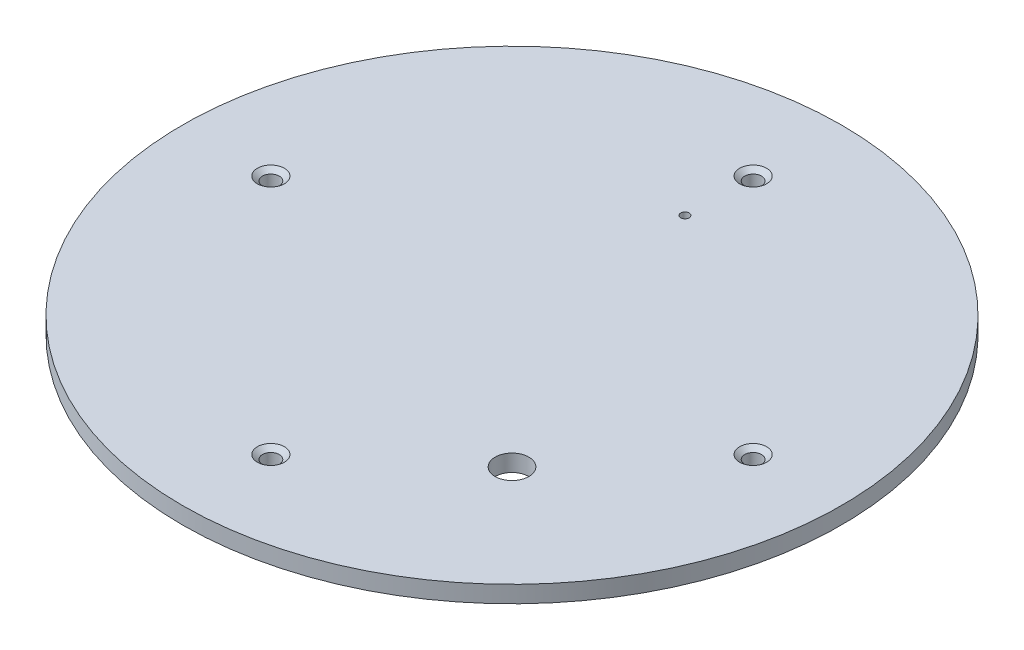
from build123d import *

# Parameters (mm, degrees)
SKETCH1_R                                       = 19.53
BOSS_EXTRUDE1_DEPTH                             = 1
CSK_FOR_M2_FLAT_HEAD_MACHINE_SCREW1_D           = 1
CSK_FOR_M2_FLAT_HEAD_MACHINE_SCREW1_CSINK_D     = 1.6
CSK_FOR_M2_FLAT_HEAD_MACHINE_SCREW1_CSINK_ANGLE = 100
CUT_EXTRUDE1_DEPTH                              = 28.637688036
CUT_EXTRUDE1_DEPTH_BACK                         = 28.637688036
SKETCH4_R                                       = 0.25
CUT_EXTRUDE2_DEPTH                              = 28.637688036
CUT_EXTRUDE2_DEPTH_BACK                         = 28.637688036
SKETCH5_R                                       = 1


with BuildPart() as part:
    # Sketch1 → Boss-Extrude1 (new body)
    with BuildSketch(Plane(origin=(0, 0, 0), x_dir=(1, 0, 0), z_dir=(0, 1, 0))):
        Circle(SKETCH1_R)
    extrude(amount=BOSS_EXTRUDE1_DEPTH)

    # CSK for M2 Flat Head Machine Screw1 (through all)
    with Locations(Plane(origin=(0, 1, 0), x_dir=(1, 0, 0), z_dir=(0, 1, 0))):
        with Locations((0, 14.29), (14.29, 0), (0, -14.29), (-14.29, 0)):
            CounterSinkHole(CSK_FOR_M2_FLAT_HEAD_MACHINE_SCREW1_D / 2, CSK_FOR_M2_FLAT_HEAD_MACHINE_SCREW1_CSINK_D / 2, counter_sink_angle=CSK_FOR_M2_FLAT_HEAD_MACHINE_SCREW1_CSINK_ANGLE)

    # Sketch4 → Cut-Extrude1 (cut, two sides: drawn at the far end of the back side and taken through both)
    with BuildSketch(Plane(origin=(0, 1, 0), x_dir=(1, 0, 0), z_dir=(0, 1, 0)).offset(-CUT_EXTRUDE1_DEPTH_BACK)):
        with Locations((0, 10.25)):
            Circle(SKETCH4_R)
    extrude(amount=CUT_EXTRUDE1_DEPTH + CUT_EXTRUDE1_DEPTH_BACK, mode=Mode.SUBTRACT)

    # Sketch5 → Cut-Extrude2 (cut, two sides: drawn at the far end of the back side and taken through both)
    with BuildSketch(Plane.XZ.offset(-CUT_EXTRUDE2_DEPTH_BACK)):
        with Locations((7.778174593, 7.778174593)):
            Circle(SKETCH5_R)
    extrude(amount=CUT_EXTRUDE2_DEPTH + CUT_EXTRUDE2_DEPTH_BACK, mode=Mode.SUBTRACT)


solid = part.part
